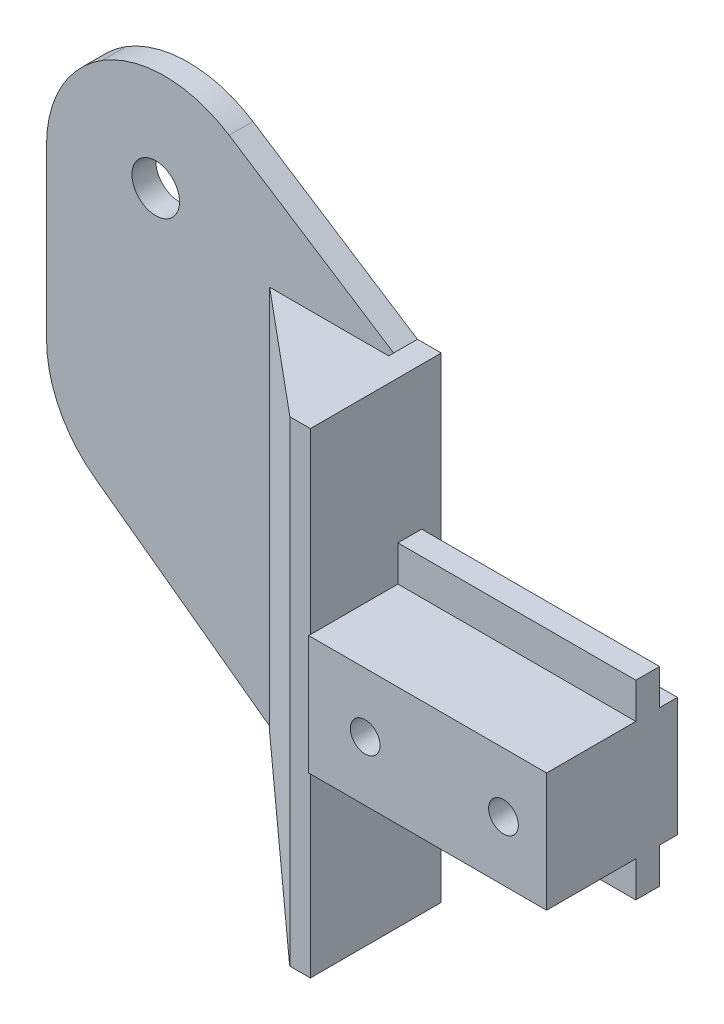
from build123d import *

# Parameters (mm, degrees)
SKETCH1_W                = 20
SKETCH1_H                = 10
BOSS_EXTRUDE1_DEPTH      = 11
BOSS_EXTRUDE2_DEPTH      = 3
BOSS_EXTRUDE2_DEPTH_BACK = 13
SKETCH2_W                = 20
SKETCH2_H                = 2
SKETCH3_W                = 11
SKETCH3_H                = 40
BOSS_EXTRUDE3_DEPTH      = 2
SKETCH5_W                = 2
SKETCH5_H                = 60
BOSS_EXTRUDE4_DEPTH      = 40
F_4_0MM_DOWEL_SLOT1_D    = 4
CUT_EXTRUDE1_DEPTH       = 40
CUT_EXTRUDE2_DEPTH       = 40
FILLET1_R                = 10
SKETCH11_W               = 53.631829023
SKETCH11_H               = 118.756200052
CUT_EXTRUDE3_DEPTH       = 40
FILLET2_R                = 10
SKETCH12_W               = 8.579575143
SKETCH12_H               = 40
BOSS_EXTRUDE5_DEPTH      = 10
CUT_EXTRUDE4_DEPTH       = 40
CUT_EXTRUDE5_DEPTH       = 40
F_2_5MM_DOWEL_SLOT1_D    = 2.5


with BuildPart() as part:
    # Sketch1 → Boss-Extrude1 (new body)
    with BuildSketch(Plane.XY):
        Rectangle(SKETCH1_W, SKETCH1_H)
    extrude(amount=BOSS_EXTRUDE1_DEPTH)

    # Sketch2 → Boss-Extrude2 (add, two sides: drawn at the far end of the back side and taken through both)
    with BuildSketch(Plane(origin=(0, 5, 0), x_dir=(1, 0, 0), z_dir=(0, 1, 0)).offset(-BOSS_EXTRUDE2_DEPTH_BACK)):
        with Locations((0, -2.5)):
            Rectangle(SKETCH2_W, SKETCH2_H)
    extrude(amount=BOSS_EXTRUDE2_DEPTH + BOSS_EXTRUDE2_DEPTH_BACK)

    # Sketch3 → Boss-Extrude3 (add)
    with BuildSketch(Plane.ZY.offset(10)):
        with Locations((5.357522791, 0)):
            Rectangle(SKETCH3_W, SKETCH3_H)
    extrude(amount=BOSS_EXTRUDE3_DEPTH)

    # Sketch5 → Boss-Extrude4 (add)
    with BuildSketch(Plane.ZY.offset(12)):
        with Locations((0.857522791, 10)):
            Rectangle(SKETCH5_W, SKETCH5_H)
    extrude(amount=BOSS_EXTRUDE4_DEPTH)

    # Ø4.0mm Dowel Slot1 (through all)
    with Locations(Plane(origin=(0, 0, -0.142477209), x_dir=(-1, 0, 0), z_dir=(0, 0, -1))):
        with Locations((32, 22)):
            Hole(F_4_0MM_DOWEL_SLOT1_D / 2)

    # Sketch9 → Cut-Extrude1 (cut)
    with BuildSketch(Plane(origin=(0, 0, -0.142477209), x_dir=(-1, 0, 0), z_dir=(0, 0, -1))):
        Polygon((12, 20), (31.113690538, 32.355186678), (52, 19.578846837), (52, 40), (12, 40), align=None)
    extrude(amount=-CUT_EXTRUDE1_DEPTH, mode=Mode.SUBTRACT)

    # Sketch10 → Cut-Extrude2 (cut)
    with BuildSketch(Plane.XY.offset(1.857522791)):
        Polygon((-12, -20), (-52, 9.223521766), (-52, -20), align=None)
    extrude(amount=-CUT_EXTRUDE2_DEPTH, mode=Mode.SUBTRACT)

    # Fillet1
    # the kernel refuses this fillet: 10 mm, written as the material it takes off along each edge
    with BuildSketch(Plane(origin=(-31.113690538, 32.355186678, -15.86551048), x_dir=(-0.8530548833247922, -0.5218212012133324, 0), z_dir=(0, 0, 1))) as fillet1_piece_1:
        with BuildLine():
            CenterArc((FILLET1_R * 0.628921330859, FILLET1_R), FILLET1_R, 205.666673807, 64.333326193)
            Line((-FILLET1_R * 0.27240777661, FILLET1_R * 0.566865101812), (0, 0))
            Line((0, 0), (FILLET1_R * 0.628921330859, 0))
        make_face()
    extrude(amount=33.446066543, mode=Mode.SUBTRACT)
    with BuildSketch(Plane(origin=(-52, 19.578846837, -14.156194501), x_dir=(0, -1, 0), z_dir=(0, 0, 1))) as fillet1_piece_2:
        with BuildLine():
            CenterArc((FILLET1_R * 0.560548691689, FILLET1_R), FILLET1_R, 211.454493545, 58.545506455)
            Line((-FILLET1_R * 0.292506191636, FILLET1_R * 0.478178798787), (0, 0))
            Line((0, 0), (FILLET1_R * 0.560548691689, 0))
        make_face()
    extrude(amount=30.027434584, mode=Mode.SUBTRACT)
    with BuildSketch(Plane(origin=(-52, 9.223521766, 14.554076611), x_dir=(0.8074608106822615, -0.5899212144111663, 0), z_dir=(0, 0, -1))) as fillet1_piece_3:
        with BuildLine():
            CenterArc((FILLET1_R * 0.507862152768, -FILLET1_R), FILLET1_R, 90, 53.848582464)
            Line((-FILLET1_R * 0.299598657914, -FILLET1_R * 0.410078785589), (0, 0))
            Line((0, 0), (FILLET1_R * 0.507862152768, 0))
        make_face()
    extrude(amount=27.393107638, mode=Mode.SUBTRACT)

    # Sketch11 → Cut-Extrude3 (cut)
    with BuildSketch(Plane.XY.offset(1.857522791)):
        with Locations((-67.994905589, 39.378925089)):
            Rectangle(SKETCH11_W, SKETCH11_H)
    extrude(amount=-CUT_EXTRUDE3_DEPTH, mode=Mode.SUBTRACT)

    # Fillet2
    # the kernel refuses this fillet: 10 mm, written as the material it takes off along each edge
    with BuildSketch(Plane(origin=(-41.178991077, 1.317822021, -12.839031028), x_dir=(0.8074608106822609, -0.589921214411167, 0), z_dir=(0, 0, 1))) as fillet2_piece_1:
        with BuildLine():
            CenterArc((FILLET2_R * 0.507862152768, FILLET2_R), FILLET2_R, 216.151417536, 53.848582464)
            Line((-FILLET2_R * 0.299598657914, FILLET2_R * 0.410078785589), (0, 0))
            Line((0, 0), (FILLET2_R * 0.507862152768, 0))
        make_face()
    extrude(amount=27.393107638, mode=Mode.SUBTRACT)
    with BuildSketch(Plane(origin=(-41.178991077, 26.198153502, 15.871240084), x_dir=(0, -1, 0), z_dir=(0, 0, -1))) as fillet2_piece_2:
        with BuildLine():
            CenterArc((FILLET2_R * 0.560548691689, -FILLET2_R), FILLET2_R, 90, 58.545506455)
            Line((-FILLET2_R * 0.292506191636, -FILLET2_R * 0.478178798787), (0, 0))
            Line((0, 0), (FILLET2_R * 0.560548691689, 0))
        make_face()
    extrude(amount=30.027434584, mode=Mode.SUBTRACT)

    # Sketch12 → Boss-Extrude5 (add)
    with BuildSketch(Plane.ZY.offset(12)):
        with Locations((6.56773522, 0)):
            Rectangle(SKETCH12_W, SKETCH12_H)
    extrude(amount=BOSS_EXTRUDE5_DEPTH)

    # Sketch13 → Cut-Extrude4 (cut)
    with BuildSketch(Plane.XZ.offset(20)):
        Polygon((-22, 2.277947648), (-11.725193368, 10.857522791), (-22, 10.857522791), align=None)
    extrude(amount=-CUT_EXTRUDE4_DEPTH, mode=Mode.SUBTRACT)

    # Sketch15 → Cut-Extrude5 (cut)
    with BuildSketch(Plane(origin=(0, 0, 2.277947648), x_dir=(-1, 0, 0), z_dir=(0, 0, -1))):
        Polygon((22, -20), (11.906976331, -20), (22, -12.461536252), align=None)
    extrude(amount=-CUT_EXTRUDE5_DEPTH, mode=Mode.SUBTRACT)

    # Ø2.5mm Dowel Slot1 (through all)
    with Locations(Plane.XY.offset(11)):
        with Locations((-5.250715138, 0), (6.374130199, 0)):
            Hole(F_2_5MM_DOWEL_SLOT1_D / 2)


solid = part.part
